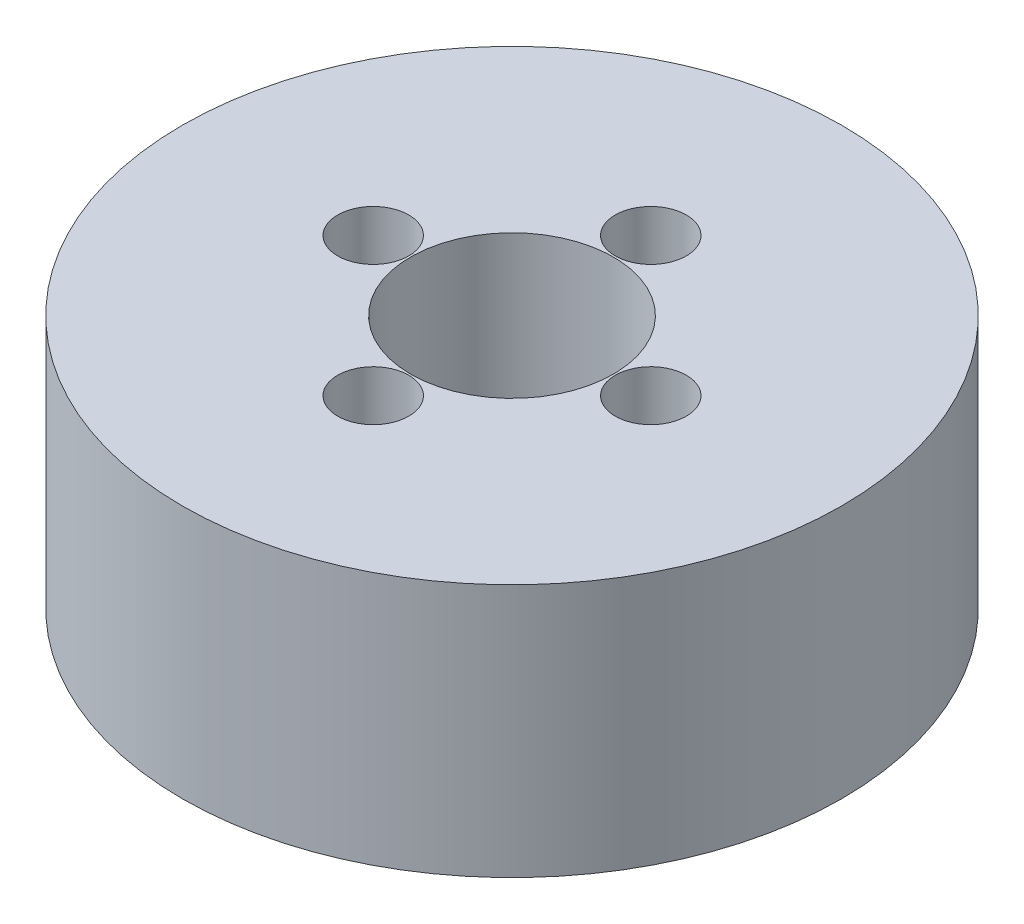
from build123d import *

# Parameters (mm, degrees)
SKETCH1_R           = 32.5
BOSS_EXTRUDE1_DEPTH = 25
SKETCH2_R           = 10
CUT_EXTRUDE1_DEPTH  = 53.321123841
SKETCH3_R           = 3.502398967
CUT_EXTRUDE2_DEPTH  = 22.974809747
CIRPATTERN1_COUNT   = 4


with BuildPart() as part:
    # Sketch1 → Boss-Extrude1 (new body)
    with BuildSketch(Plane(origin=(0, 0, 0), x_dir=(1, 0, 0), z_dir=(0, 1, 0))):
        Circle(SKETCH1_R)
    extrude(amount=BOSS_EXTRUDE1_DEPTH)

    # Sketch2 → Cut-Extrude1 (cut, through all)
    with BuildSketch(Plane(origin=(0, 0, 0), x_dir=(1, 0, 0), z_dir=(0, 1, 0))):
        Circle(SKETCH2_R)
    extrude(amount=CUT_EXTRUDE1_DEPTH, mode=Mode.SUBTRACT)

    # Sketch3 → Cut-Extrude2 (cut)
    with BuildSketch(Plane(origin=(0, 25, 0), x_dir=(1, 0, 0), z_dir=(0, 1, 0))):
        with Locations((-13.680179401, 0)):
            Circle(SKETCH3_R)
    cut_extrude2 = extrude(amount=-CUT_EXTRUDE2_DEPTH, mode=Mode.SUBTRACT)

    # CirPattern1: Cut-Extrude2 ×4 about axis
    cirpattern1_axis = Axis((0, 0, 0), (0, 1, 0))
    for i in range(1, CIRPATTERN1_COUNT):
        add(cut_extrude2.rotate(cirpattern1_axis, i * 360 / CIRPATTERN1_COUNT), mode=Mode.SUBTRACT)


solid = part.part
